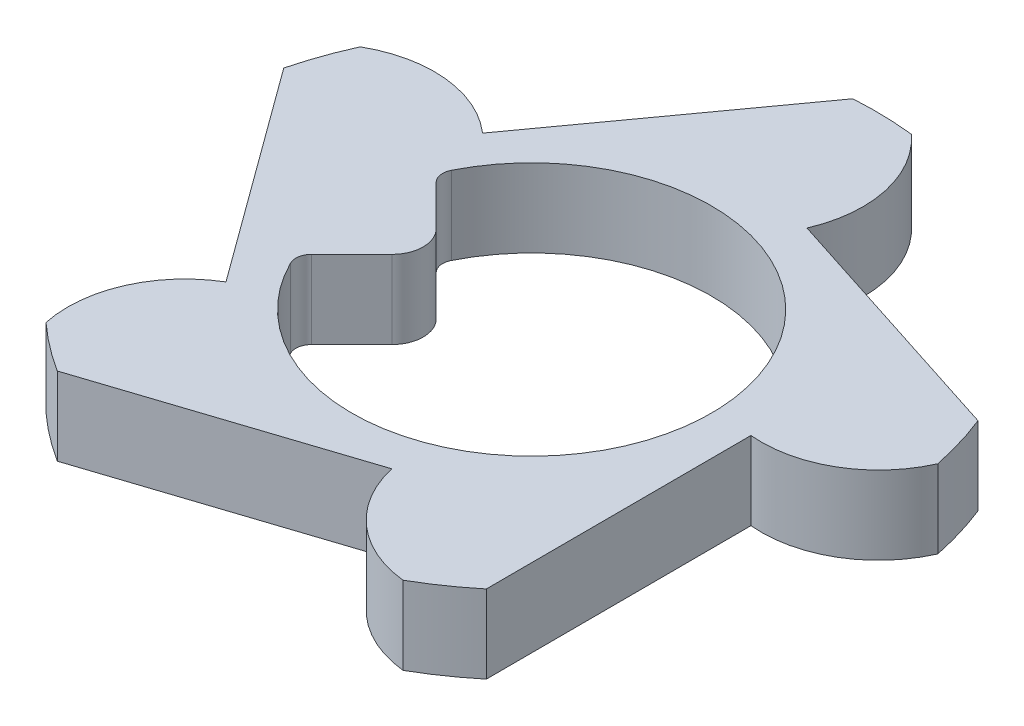
from build123d import *

# Parameters (mm, degrees)
BOSS_EXTRUDE1_DEPTH = 0.5
CUT_EXTRUDE1_REACH  = 5.12
FILLET1_R           = 0.1
FILLET2_R           = 0.2


with BuildPart() as part:
    # Sketch1 → Boss-Extrude1 (new body)
    with BuildSketch(Plane(origin=(0, 0, 0), x_dir=(1, 0, 0), z_dir=(0, 1, 0))):
        with BuildLine():
            Line((-1.130713076, -0.825522828), (-2.131397859, 0.545108401))
            ThreePointArc((-2.131397859, 0.545108401), (-2.07578756, 0.7287702), (-2.004384052, 0.906887298))
            ThreePointArc((-2.004384052, 0.906887298), (-1.555532522, 1.003410855), (-1.134528421, 0.820271456))
            Line((-1.134528421, 0.820271456), (-0.140209263, 2.195527582))
            ThreePointArc((-0.140209263, 2.195527582), (0.051648015, 2.199393662), (0.243112339, 2.186526101))
            ThreePointArc((0.243112339, 2.186526101), (0.473614448, 1.789470348), (0.42953595, 1.332478468))
            Line((0.42953595, 1.332478468), (2.044743768, 0.811802268))
            ThreePointArc((2.044743768, 0.811802268), (2.107707789, 0.630529838), (2.154635741, 0.444460149))
            ThreePointArc((2.154635741, 0.444460149), (1.848242349, 0.102542642), (1.399996238, 0.003245527))
            Line((1.399996238, 0.003245527), (1.40393041, -1.693806188))
            ThreePointArc((1.40393041, -1.693806188), (1.250987037, -1.809704792), (1.088525782, -1.911834622))
            ThreePointArc((1.088525782, -1.911834622), (0.668662143, -1.726095511), (0.435709309, -1.330472622))
            Line((0.435709309, -1.330472622), (-1.177067057, -1.858632063))
            ThreePointArc((-1.177067057, -1.858632063), (-1.33455528, -1.748988909), (-1.48188981, -1.626038927))
            ThreePointArc((-1.48188981, -1.626038927), (-1.434986417, -1.169328335), (-1.130713076, -0.825522828))
        make_face()
    extrude(amount=BOSS_EXTRUDE1_DEPTH)

    # Sketch2 → Cut-Extrude1 (cut, up to next)
    with BuildSketch(Plane(origin=(0, 0.5, 0), x_dir=(1, 0, 0), z_dir=(0, 1, 0)), mode=Mode.PRIVATE) as cut_extrude1_sk1:
        with BuildLine():
            Line((-1.059104505, 0.448104505), (-0.611, 0))
            Line((-0.611, 0), (-1.059104505, -0.448104505))
            ThreePointArc((-1.059104505, -0.448104505), (1.15, 0), (-1.059104505, 0.448104505))
        make_face()
    cut_extrude1_tool1 = extrude(cut_extrude1_sk1.sketch, amount=-CUT_EXTRUDE1_REACH, mode=Mode.PRIVATE) & part.part
    add(cut_extrude1_tool1.solids().sort_by_distance((0.062233, 0.5, 0))[0], mode=Mode.SUBTRACT)

    # Fillet1
    fillet1_edges = [part.edges().sort_by_distance(p)[0] for p in [
        (-1.059104505, 0.25, 0.448104505),
        (-1.059104505, 0.25, -0.448104505),
    ]]
    fillet(fillet1_edges, radius=FILLET1_R)

    # Fillet2
    fillet2_edges = [part.edges().sort_by_distance(p)[0] for p in [
        (-0.611, 0.25, 0),
    ]]
    fillet(fillet2_edges, radius=FILLET2_R)


solid = part.part
